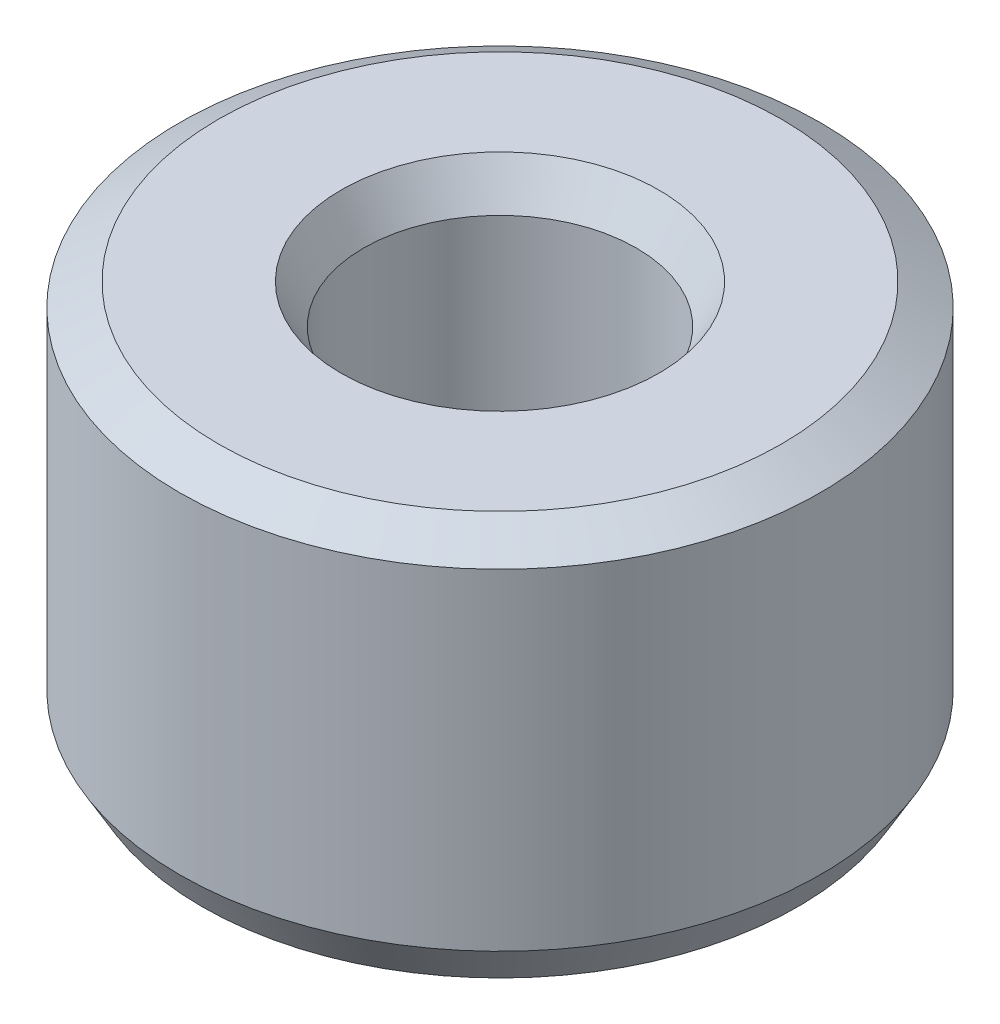
from build123d import *
from OCP.BRepFilletAPI import BRepFilletAPI_MakeChamfer

# Parameters (mm, degrees)
SKETCH1_R           = 30
BOSS_EXTRUDE1_DEPTH = 36.736297863
SKETCH2_R           = 12.76160851
CUT_EXTRUDE1_DEPTH  = 57.12090146
CHAMFER1_SIZE       = 2.108956915
CHAMFER1_SIZE2      = 3.652820529


with BuildPart() as part:
    # Sketch1 → Boss-Extrude1 (new body)
    with BuildSketch(Plane(origin=(0, 0, 0), x_dir=(1, 0, 0), z_dir=(0, 1, 0))):
        Circle(SKETCH1_R)
    extrude(amount=BOSS_EXTRUDE1_DEPTH)

    # Sketch2 → Cut-Extrude1 (cut, through all)
    with BuildSketch(Plane(origin=(0, 0, 0), x_dir=(1, 0, 0), z_dir=(0, 1, 0))):
        Circle(SKETCH2_R)
    extrude(amount=CUT_EXTRUDE1_DEPTH, mode=Mode.SUBTRACT)

    # Chamfer1: one chamfer whose edges measure the first distance from different faces: ONE call of the kernel's chamfer builder (chamfer() names one face for all edges)
    chamfer1_edges_1 = [part.edges().sort_by_distance(p)[0] for p in [
        (-12.76160851, 36.736297863, 0),
    ]]
    chamfer1_side_1 = [part.faces().sort_by_distance(p)[0] for p in [
        (-29.151471863, 36.736297863, 0),
    ]]
    chamfer1_edges_2 = [part.edges().sort_by_distance(p)[0] for p in [
        (-12.76160851, 0, 0),
    ]]
    chamfer1_side_2 = [part.faces().sort_by_distance(p)[0] for p in [
        (-12.76160851, 18.368148932, 0),
    ]]
    chamfer1_edges_3 = [part.edges().sort_by_distance(p)[0] for p in [
        (-30, 0, 0),
    ]]
    chamfer1_side_3 = [part.faces().sort_by_distance(p)[0] for p in [
        (-29.151471863, 0, 0),
    ]]
    chamfer1_edges_4 = [part.edges().sort_by_distance(p)[0] for p in [
        (-30, 36.736297863, 0),
    ]]
    chamfer1_side_4 = [part.faces().sort_by_distance(p)[0] for p in [
        (-30, 18.368148932, 0),
    ]]
    chamfer1 = BRepFilletAPI_MakeChamfer(part.part.solid().wrapped)
    for e in chamfer1_edges_1:
        chamfer1.Add(CHAMFER1_SIZE, CHAMFER1_SIZE2, e.wrapped, chamfer1_side_1[0].wrapped)  # the first distance lies on this face
    for e in chamfer1_edges_2:
        chamfer1.Add(CHAMFER1_SIZE, CHAMFER1_SIZE2, e.wrapped, chamfer1_side_2[0].wrapped)  # the first distance lies on this face
    for e in chamfer1_edges_3:
        chamfer1.Add(CHAMFER1_SIZE, CHAMFER1_SIZE2, e.wrapped, chamfer1_side_3[0].wrapped)  # the first distance lies on this face
    for e in chamfer1_edges_4:
        chamfer1.Add(CHAMFER1_SIZE, CHAMFER1_SIZE2, e.wrapped, chamfer1_side_4[0].wrapped)  # the first distance lies on this face
    add(Compound.cast(chamfer1.Shape()), mode=Mode.REPLACE)


solid = part.part
